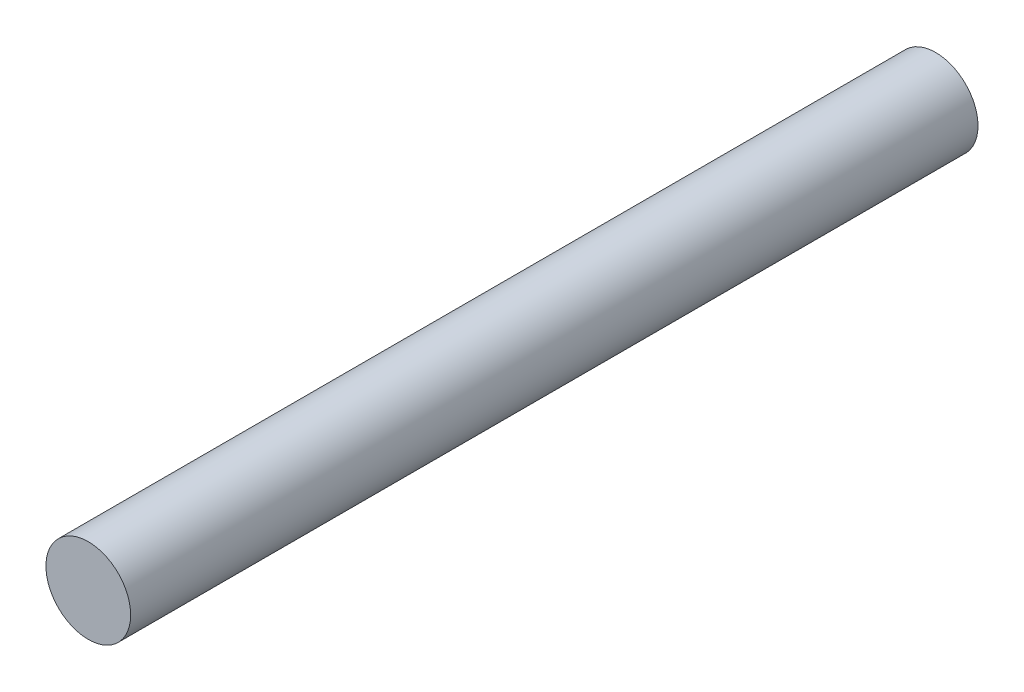
from build123d import *

# Parameters (mm, degrees)
SKETCH_1_R      = 3
EXTRUDE_1_DEPTH = 60


with BuildPart() as part:
    # 草图1 → 凸台-拉伸1 (new body)
    with BuildSketch(Plane.XY):
        Circle(SKETCH_1_R)
    extrude(amount=EXTRUDE_1_DEPTH)


solid = part.part
